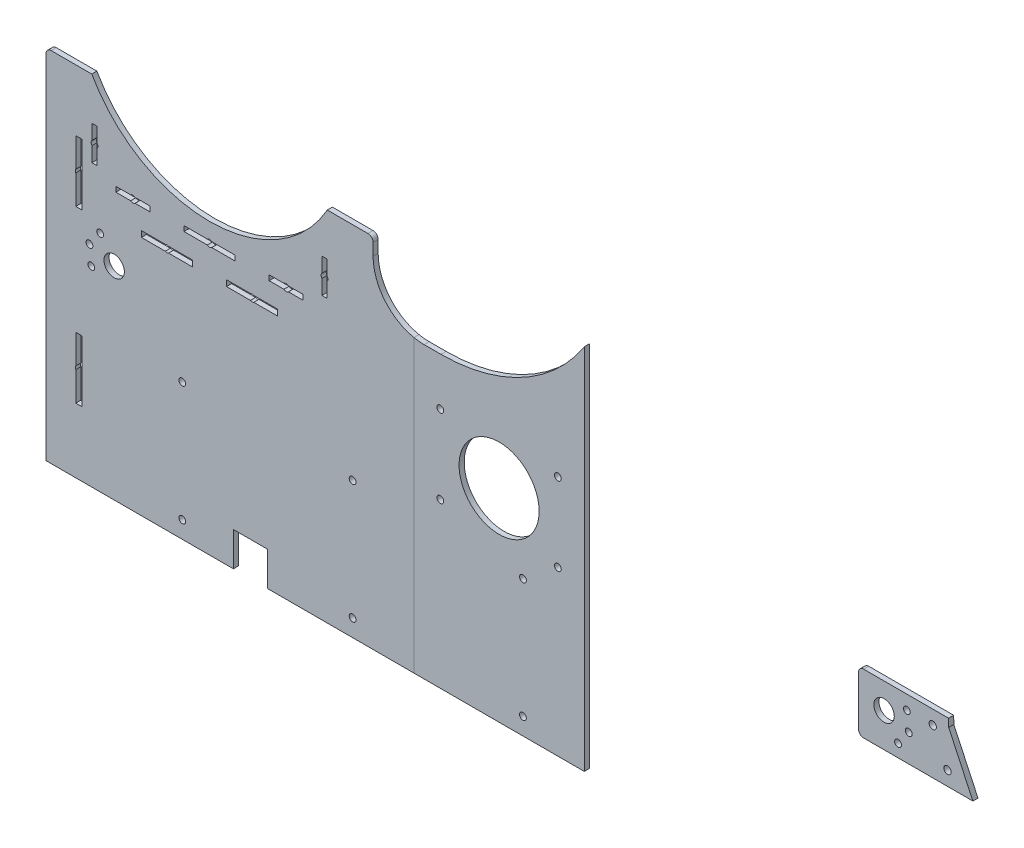
from build123d import *

# Parameters (mm, degrees)
SKETCH_1_R                   = 2
SKETCH_1_R_2                 = 6
SKETCH_1_R_3                 = 23.5
EXTRUDE_1_DEPTH              = 3
FILLET_1_R                   = 100
FILLET_2_R                   = 3
CUT_EXTRUDE_1_DEPTH          = 10
FILLET_3_R                   = 30
SKETCH_8_R                   = 2
EXTRUDE_5_DEPTH              = 3
SKETCH_7_R                   = 2
CUT_EXTRUDE_6_DEPTH          = 627.829093668
CUT_EXTRUDE_START            = -10
CUT_EXTRUDE_7_DEPTH          = 10
SPLIT_START                  = 63
SPLIT_BODIES_1_OUTLINE_W     = 622
SPLIT_BODIES_1_OUTLINE_H     = 3
SPLIT_BODIES_1_DEPTH         = 314.227231476
SPLIT_BODIES_1_2_OUTLINE_R   = 2
SPLIT_BODIES_1_2_DEPTH       = 3
SPLIT_BODIES_1_3_OUTLINE_R   = 2
SPLIT_BODIES_1_3_OUTLINE_R_2 = 23.5
SPLIT_BODIES_1_3_DEPTH       = 3
SKETCH_11_W                  = 23
SKETCH_11_H                  = 23
CUT_EXTRUDE_8_DEPTH          = 10
SKETCH_12_R                  = 5.999999999
SKETCH_12_R_2                = 1.999999999
CUT_EXTRUDE_9_DEPTH          = 10
SKETCH_13_R                  = 2
CUT_EXTRUDE_10_DEPTH         = 10
SKETCH_14_R                  = 2
CUT_EXTRUDE_11_DEPTH         = 10
SKETCH_15_OUTSIDE_W          = 695.481
SKETCH_15_OUTSIDE_H          = 785.859
SKETCH_15_OUTSIDE_W_2        = 88.236351933
SKETCH_15_OUTSIDE_H_2        = 35
CUT_EXTRUDE_12_DEPTH         = 10
EXTRUDE_6_DEPTH              = 3
FILLET_4_R                   = 3
SKETCH_17_R                  = 2.15
CUT_EXTRUDE_13_DEPTH         = 3


# Read off the part's stored shape, not the designer's step: 分割1
with BuildPart() as part:
    # 草图1 → 凸台-拉伸1 (new body)
    with BuildSketch(Plane.XY):
        with BuildLine():
            Line((-153, 90), (-153, -50))
            Line((-153, -50), (-43, -50))
            Line((-43, -50), (-43, -30))
            Line((-43, -30), (-23, -30))
            Line((-23, -30), (-23, -50))
            Line((-23, -50), (186, -50))
            Line((186, -50), (186, -27))
            Line((186, -27), (208, -27))
            Line((208, -27), (208, -50))
            Line((208, -50), (377, -50))
            Line((377, -50), (377, -40))
            ThreePointArc((377, -40), (351.416576428, 236.539566066), (265.404312441, 500.604962521))
            Line((265.404312441, 500.604962521), (265.404312441, 285))
            Line((265.404312441, 285), (162.933559346, 285))
            ThreePointArc((162.933559346, 285), (177.824282666, 167.941273759), (181.610438264, 50))
            Line((181.610438264, 50), (39, 50))
            Line((39, 50), (39, 90))
            Line((39, 90), (-153, 90))
        make_face()
        with Locations((-126.387569495, -7.765573369)):
            Circle(SKETCH_1_R, mode=Mode.SUBTRACT)
        with Locations((-127.488887394, 2.882285677)):
            Circle(SKETCH_1_R, mode=Mode.SUBTRACT)
        with Locations((-113, -1)):
            Circle(SKETCH_1_R_2, mode=Mode.SUBTRACT)
        with Locations((-73, -40)):
            Circle(SKETCH_1_R, mode=Mode.SUBTRACT)
        with Locations((-121.211188593, 11.552943156)):
            Circle(SKETCH_1_R, mode=Mode.SUBTRACT)
        with BuildLine():
            Line((-135.5, 36.968245837), (-135.5, 54))
            Line((-135.5, 54), (-132, 54))
            Line((-132, 54), (-132, 36.968245837))
            ThreePointArc((-132, 36.968245837), (-131.75, 36), (-132, 35.031754163))
            Line((-132, 35.031754163), (-132, 18))
            Line((-132, 18), (-135.5, 18))
            Line((-135.5, 18), (-135.5, 35.031754163))
            ThreePointArc((-135.5, 35.031754163), (-135.75, 36), (-135.5, 36.968245837))
        make_face(mode=Mode.SUBTRACT)
        with BuildLine():
            Line((-92, 40), (-92, 37))
            Line((-92, 37), (-100.677124344, 37))
            ThreePointArc((-100.677124344, 37), (-102, 36.5), (-103.322875656, 37))
            Line((-103.322875656, 37), (-112, 37))
            Line((-112, 37), (-112, 40))
            Line((-112, 40), (-103.322875656, 40))
            ThreePointArc((-103.322875656, 40), (-102, 40.5), (-100.677124344, 40))
            Line((-100.677124344, 40), (-92, 40))
        make_face(mode=Mode.SUBTRACT)
        with BuildLine():
            Line((-126, 56.322875656), (-126, 65))
            Line((-126, 65), (-123, 65))
            Line((-123, 65), (-123, 56.322875656))
            ThreePointArc((-123, 56.322875656), (-122.5, 55), (-123, 53.677124344))
            Line((-123, 53.677124344), (-123, 45))
            Line((-123, 45), (-126, 45))
            Line((-126, 45), (-126, 53.677124344))
            ThreePointArc((-126, 53.677124344), (-126.5, 55), (-126, 56.322875656))
        make_face(mode=Mode.SUBTRACT)
        with BuildLine():
            Line((-97, 21.5), (-97, 25))
            Line((-97, 25), (-82.968245837, 25))
            ThreePointArc((-82.968245837, 25), (-82, 25.25), (-81.031754163, 25))
            Line((-81.031754163, 25), (-67, 25))
            Line((-67, 25), (-67, 21.5))
            Line((-67, 21.5), (-81.031754163, 21.5))
            ThreePointArc((-81.031754163, 21.5), (-82, 21.25), (-82.968245837, 21.5))
            Line((-82.968245837, 21.5), (-97, 21.5))
        make_face(mode=Mode.SUBTRACT)
        with BuildLine():
            Line((-72, 37), (-72, 40))
            Line((-72, 40), (-58.322875656, 40))
            ThreePointArc((-58.322875656, 40), (-57, 40.5), (-55.677124344, 40))
            Line((-55.677124344, 40), (-42, 40))
            Line((-42, 40), (-42, 37))
            Line((-42, 37), (-55.677124344, 37))
            ThreePointArc((-55.677124344, 37), (-57, 36.5), (-58.322875656, 37))
            Line((-58.322875656, 37), (-72, 37))
        make_face(mode=Mode.SUBTRACT)
        with BuildLine():
            Line((-47, 21.5), (-47, 25))
            Line((-47, 25), (-32.968245837, 25))
            ThreePointArc((-32.968245837, 25), (-32, 25.25), (-31.031754163, 25))
            Line((-31.031754163, 25), (-17, 25))
            Line((-17, 25), (-17, 21.5))
            Line((-17, 21.5), (-31.031754163, 21.5))
            ThreePointArc((-31.031754163, 21.5), (-32, 21.25), (-32.968245837, 21.5))
            Line((-32.968245837, 21.5), (-47, 21.5))
        make_face(mode=Mode.SUBTRACT)
        with Locations((27, -40)):
            Circle(SKETCH_1_R, mode=Mode.SUBTRACT)
        with BuildLine():
            Line((-22, 37), (-22, 40))
            Line((-22, 40), (-13.322875656, 40))
            ThreePointArc((-13.322875656, 40), (-12, 40.5), (-10.677124344, 40))
            Line((-10.677124344, 40), (-2, 40))
            Line((-2, 40), (-2, 37))
            Line((-2, 37), (-10.677124344, 37))
            ThreePointArc((-10.677124344, 37), (-12, 36.5), (-13.322875656, 37))
            Line((-13.322875656, 37), (-22, 37))
        make_face(mode=Mode.SUBTRACT)
        with BuildLine():
            Line((12, 53.677124344), (12, 45))
            Line((12, 45), (9, 45))
            Line((9, 45), (9, 53.677124344))
            ThreePointArc((9, 53.677124344), (8.5, 55), (9, 56.322875656))
            Line((9, 56.322875656), (9, 65))
            Line((9, 65), (12, 65))
            Line((12, 65), (12, 56.322875656))
            ThreePointArc((12, 56.322875656), (12.5, 55), (12, 53.677124344))
        make_face(mode=Mode.SUBTRACT)
        with Locations((127, -40)):
            Circle(SKETCH_1_R, mode=Mode.SUBTRACT)
        with Locations((113, -1)):
            Circle(SKETCH_1_R_3, mode=Mode.SUBTRACT)
        with Locations((227, -40)):
            Circle(SKETCH_1_R, mode=Mode.SUBTRACT)
        with Locations((197, 36.410161514)):
            Circle(SKETCH_1_R, mode=Mode.SUBTRACT)
        with Locations((197, 76.410161514)):
            Circle(SKETCH_1_R, mode=Mode.SUBTRACT)
        with Locations((277, -40)):
            Circle(SKETCH_1_R, mode=Mode.SUBTRACT)
        with Locations((327, -40)):
            Circle(SKETCH_1_R, mode=Mode.SUBTRACT)
        with Locations((197, 116.410161514)):
            Circle(SKETCH_1_R, mode=Mode.SUBTRACT)
        with Locations((197, 156.410161514)):
            Circle(SKETCH_1_R, mode=Mode.SUBTRACT)
        with Locations((197, 196.410161514)):
            Circle(SKETCH_1_R, mode=Mode.SUBTRACT)
        with Locations((197, 236.410161514)):
            Circle(SKETCH_1_R, mode=Mode.SUBTRACT)
        with Locations((266.652617784, 221.656683726)):
            Circle(SKETCH_1_R, mode=Mode.SUBTRACT)
        with Locations((283.594692637, 185.421809645)):
            Circle(SKETCH_1_R, mode=Mode.SUBTRACT)
        with Locations((249.710542931, 257.891557807)):
            Circle(SKETCH_1_R, mode=Mode.SUBTRACT)
        with Locations((275.404312441, 415)):
            Circle(SKETCH_1_R, mode=Mode.SUBTRACT)
    extrude(amount=EXTRUDE_1_DEPTH)

    # 圆角1
    fillet_1_edges = [part.edges().sort_by_distance(p)[0] for p in [
        (181.610438264, 50, 1.5),
    ]]
    fillet(fillet_1_edges, radius=FILLET_1_R)

    # 圆角2
    fillet_2_edges = [part.edges().sort_by_distance(p)[0] for p in [
        (162.933559346, 285, 1.5),
        (-153, 90, 1.5),
        (39, 90, 1.5),
    ]]
    fillet(fillet_2_edges, radius=FILLET_2_R)

    # 草图3 → 切除-旋转1 (revolve, cut)
    with BuildSketch(Plane.XY.offset(93)):
        with BuildLine():
            Line((-57, 249), (-57, 9))
            ThreePointArc((-57, 9), (63, 129), (-57, 249))
        make_face()
    revolve(axis=Axis((-57, -897.264284178, 93), (0, 1, 0)), mode=Mode.SUBTRACT)

    # 草图4 → 切除-拉伸1 (cut)
    with BuildSketch(Plane.XY.offset(3)):
        with BuildLine():
            Line((12.130311731, 90), (8.038450166, 90))
            ThreePointArc((8.038450166, 90), (-57, 53.164652041), (-122.038450166, 90))
            Line((-122.038450166, 90), (-126.130311731, 90))
            ThreePointArc((-126.130311731, 90), (-57, 49.627460668), (12.130311731, 90))
        make_face()
    extrude(amount=-CUT_EXTRUDE_1_DEPTH, mode=Mode.SUBTRACT)

    # 圆角3
    fillet_3_edges = [part.edges().sort_by_distance(p)[0] for p in [
        (39, 50, 1.5),
    ]]
    fillet(fillet_3_edges, radius=FILLET_3_R)

    # 草图8 → 凸台-拉伸5 (add)
    with BuildSketch(Plane.XY.offset(3)):
        Polygon((-43, -50), (-153, -50), (-153, -120), (-43, -120), (-43, -100), (-23, -100), (-23, -120), (186, -120), (186, -97), (208, -97), (208, -120), (377, -120), (377, -50), (208, -50), (208, -27), (186, -27), (186, -50), (-23, -50), (-23, -30), (-43, -30), align=None)
        with Locations((-73, -110)):
            Circle(SKETCH_8_R, mode=Mode.SUBTRACT)
        with Locations((27, -110)):
            Circle(SKETCH_8_R, mode=Mode.SUBTRACT)
        with Locations((127, -110)):
            Circle(SKETCH_8_R, mode=Mode.SUBTRACT)
        with Locations((227, -110)):
            Circle(SKETCH_8_R, mode=Mode.SUBTRACT)
        with Locations((277, -110)):
            Circle(SKETCH_8_R, mode=Mode.SUBTRACT)
        with Locations((327, -110)):
            Circle(SKETCH_8_R, mode=Mode.SUBTRACT)
    extrude(amount=-EXTRUDE_5_DEPTH)

    # 草图7 → 切除-拉伸6 (cut, through all)
    with BuildSketch(Plane.XY.offset(3)):
        with Locations((78.5, 22)):
            Circle(SKETCH_7_R)
        with Locations((147.5, 22)):
            Circle(SKETCH_7_R)
        with Locations((147.5, -24)):
            Circle(SKETCH_7_R)
        with Locations((78.5, -24)):
            Circle(SKETCH_7_R)
    extrude(amount=-CUT_EXTRUDE_6_DEPTH, mode=Mode.SUBTRACT)

    # 草图9 → 切除-拉伸7 (cut)
    with BuildSketch(Plane.XY.offset(3).offset(CUT_EXTRUDE_START)):
        with BuildLine():
            Line((-135.5, 35.031754163), (-135.5, 18))
            Line((-135.5, 18), (-132, 18))
            Line((-132, 18), (-132, 35.031754163))
            ThreePointArc((-132, 35.031754163), (-131.75, 36), (-132, 36.968245837))
            Line((-132, 36.968245837), (-132, 54))
            Line((-132, 54), (-135.5, 54))
            Line((-135.5, 54), (-135.5, 36.968245837))
            ThreePointArc((-135.5, 36.968245837), (-135.75, 36), (-135.5, 35.031754163))
        make_face()
        with BuildLine():
            Line((-132, -46), (-132, -63.031754163))
            ThreePointArc((-132, -63.031754163), (-131.75, -64), (-132, -64.968245837))
            Line((-132, -64.968245837), (-132, -82))
            Line((-132, -82), (-135.5, -82))
            Line((-135.5, -82), (-135.5, -64.968245837))
            ThreePointArc((-135.5, -64.968245837), (-135.75, -64), (-135.5, -63.031754163))
            Line((-135.5, -63.031754163), (-135.5, -46))
            Line((-135.5, -46), (-132, -46))
        make_face()
    extrude(amount=CUT_EXTRUDE_7_DEPTH, mode=Mode.SUBTRACT)

    # Split Bodies 1 outline → Split Bodies 1 (cut)
    with BuildSketch(Plane.YZ.offset(SPLIT_START)):
        with Locations((191, 1.5)):
            Rectangle(SPLIT_BODIES_1_OUTLINE_W, SPLIT_BODIES_1_OUTLINE_H)
    extrude(amount=SPLIT_BODIES_1_DEPTH, mode=Mode.SUBTRACT)


with BuildPart() as body_2:
    # Split Bodies 1 2 outline → Split Bodies 1 2 (new body)
    with BuildSketch(Plane.XY):
        with BuildLine():
            Line((163, 95.910737705), (163, -120))
            Line((163, -120), (186, -120))
            Line((186, -120), (186, -97))
            Line((186, -97), (208, -97))
            Line((208, -97), (208, -120))
            Line((208, -120), (377, -120))
            Line((377, -120), (377, -40))
            ThreePointArc((377, -40), (351.416576428, 236.539566066), (265.404312441, 500.604962521))
            Line((265.404312441, 500.604962521), (265.404312441, 285))
            Line((265.404312441, 285), (166.500797038, 285))
            ThreePointArc((166.500797038, 285), (164.206174437, 283.932539034), (163.544498541, 281.489804745))
            ThreePointArc((163.544498541, 281.489804745), (172.654031933, 219.459988457), (178.641910806, 157.051439252))
            ThreePointArc((178.641910806, 157.051439252), (175.770623293, 125.214791859), (163, 95.910737705))
        make_face()
        with Locations((227, -110)):
            Circle(SPLIT_BODIES_1_2_OUTLINE_R, mode=Mode.SUBTRACT)
        with Locations((227, -40)):
            Circle(SPLIT_BODIES_1_2_OUTLINE_R, mode=Mode.SUBTRACT)
        with Locations((197, 36.410161514)):
            Circle(SPLIT_BODIES_1_2_OUTLINE_R, mode=Mode.SUBTRACT)
        with Locations((197, 76.410161514)):
            Circle(SPLIT_BODIES_1_2_OUTLINE_R, mode=Mode.SUBTRACT)
        with Locations((197, 116.410161514)):
            Circle(SPLIT_BODIES_1_2_OUTLINE_R, mode=Mode.SUBTRACT)
        with Locations((197, 156.410161514)):
            Circle(SPLIT_BODIES_1_2_OUTLINE_R, mode=Mode.SUBTRACT)
        with Locations((277, -110)):
            Circle(SPLIT_BODIES_1_2_OUTLINE_R, mode=Mode.SUBTRACT)
        with Locations((277, -40)):
            Circle(SPLIT_BODIES_1_2_OUTLINE_R, mode=Mode.SUBTRACT)
        with Locations((327, -110)):
            Circle(SPLIT_BODIES_1_2_OUTLINE_R, mode=Mode.SUBTRACT)
        with Locations((327, -40)):
            Circle(SPLIT_BODIES_1_2_OUTLINE_R, mode=Mode.SUBTRACT)
        with Locations((283.594692637, 185.421809645)):
            Circle(SPLIT_BODIES_1_2_OUTLINE_R, mode=Mode.SUBTRACT)
        with Locations((197, 196.410161514)):
            Circle(SPLIT_BODIES_1_2_OUTLINE_R, mode=Mode.SUBTRACT)
        with Locations((197, 236.410161514)):
            Circle(SPLIT_BODIES_1_2_OUTLINE_R, mode=Mode.SUBTRACT)
        with Locations((266.652617784, 221.656683726)):
            Circle(SPLIT_BODIES_1_2_OUTLINE_R, mode=Mode.SUBTRACT)
        with Locations((249.710542931, 257.891557807)):
            Circle(SPLIT_BODIES_1_2_OUTLINE_R, mode=Mode.SUBTRACT)
        with Locations((275.404312441, 415)):
            Circle(SPLIT_BODIES_1_2_OUTLINE_R, mode=Mode.SUBTRACT)
    extrude(amount=SPLIT_BODIES_1_2_DEPTH)

    # 草图11 → 切除-拉伸8 (cut)
    with BuildSketch(Plane.XY.offset(3)):
        with Locations((174.5, -108.5)):
            Rectangle(SKETCH_11_W, SKETCH_11_H)
    extrude(amount=-CUT_EXTRUDE_8_DEPTH, mode=Mode.SUBTRACT)

    # 草图12 → 切除-拉伸9 (cut)
    with BuildSketch(Plane.XY.offset(3)):
        with Locations((339.000000001, -0.999999999)):
            Circle(SKETCH_12_R)
        with Locations((353.488887395, -4.882285676)):
            Circle(SKETCH_12_R_2)
        with Locations((347.211188594, -13.552943156)):
            Circle(SKETCH_12_R_2)
        with Locations((352.387569496, 5.76557337)):
            Circle(SKETCH_12_R_2)
    extrude(amount=-CUT_EXTRUDE_9_DEPTH, mode=Mode.SUBTRACT)

    # 草图13 → 切除-拉伸10 (cut)
    with BuildSketch(Plane.XY.offset(3)):
        with Locations((197, -80)):
            Circle(SKETCH_13_R)
        with Locations((197, -60)):
            Circle(SKETCH_13_R)
    extrude(amount=-CUT_EXTRUDE_10_DEPTH, mode=Mode.SUBTRACT)

    # 草图14 → 切除-拉伸11 (cut)
    with BuildSketch(Plane.XY.offset(3)):
        with Locations((183, 41.295936886)):
            Circle(SKETCH_14_R)
    extrude(amount=-CUT_EXTRUDE_11_DEPTH, mode=Mode.SUBTRACT)

    # 草图15 outside → 切除-拉伸12 (cut)
    with BuildSketch(Plane.XY.offset(3)):
        with Locations((112.1135, 190.3025)):
            Rectangle(SKETCH_15_OUTSIDE_W, SKETCH_15_OUTSIDE_H)
        with Locations((368.118175968, -3.499999999)):
            Rectangle(SKETCH_15_OUTSIDE_W_2, SKETCH_15_OUTSIDE_H_2, mode=Mode.SUBTRACT)
    extrude(amount=-CUT_EXTRUDE_12_DEPTH, mode=Mode.SUBTRACT)

    # 草图16 → 凸台-拉伸6 (add)
    with BuildSketch(Plane.XY.offset(3)):
        with BuildLine():
            Line((391.148916275, -20.999999999), (376.967146193, 9.331270381))
            ThreePointArc((376.967146193, 9.331270381), (377.18452175, -5.833604226), (377.217887055, -20.999999999))
            Line((377.217887055, -20.999999999), (391.148916275, -20.999999999))
        make_face()
    extrude(amount=-EXTRUDE_6_DEPTH)

    # 圆角4
    fillet_4_edges = [body_2.edges().sort_by_distance(p)[0] for p in [
        (324.000000001, -20.999999999, 1.5),
        (324.000000001, 14.000000001, 1.5),
    ]]
    fillet(fillet_4_edges, radius=FILLET_4_R)

    # 草图17 → 切除-拉伸13 (cut)
    with BuildSketch(Plane.XY.offset(3)):
        with Locations((376.224335271, -12.689901349)):
            Circle(SKETCH_17_R)
        with Locations((367.567061049, 5.825849765)):
            Circle(SKETCH_17_R)
    extrude(amount=-CUT_EXTRUDE_13_DEPTH, mode=Mode.SUBTRACT)


with BuildPart() as body_3:
    # Split Bodies 1 3 outline → Split Bodies 1 3 (new body)
    with BuildSketch(Plane.XY):
        with BuildLine():
            Line((63, 50.606123087), (63, -120))
            Line((63, -120), (163, -120))
            Line((163, -120), (163, 95.910737705))
            ThreePointArc((163, 95.910737705), (126.802596049, 62.224928854), (78.890834599, 50))
            Line((78.890834599, 50), (69, 50))
            ThreePointArc((69, 50), (65.98473114, 50.15191541), (63, 50.606123087))
        make_face()
        with Locations((78.5, -24)):
            Circle(SPLIT_BODIES_1_3_OUTLINE_R, mode=Mode.SUBTRACT)
        with Locations((127, -110)):
            Circle(SPLIT_BODIES_1_3_OUTLINE_R, mode=Mode.SUBTRACT)
        with Locations((127, -40)):
            Circle(SPLIT_BODIES_1_3_OUTLINE_R, mode=Mode.SUBTRACT)
        with Locations((147.5, -24)):
            Circle(SPLIT_BODIES_1_3_OUTLINE_R, mode=Mode.SUBTRACT)
        with Locations((78.5, 22)):
            Circle(SPLIT_BODIES_1_3_OUTLINE_R, mode=Mode.SUBTRACT)
        with Locations((113, -1)):
            Circle(SPLIT_BODIES_1_3_OUTLINE_R_2, mode=Mode.SUBTRACT)
        with Locations((147.5, 22)):
            Circle(SPLIT_BODIES_1_3_OUTLINE_R, mode=Mode.SUBTRACT)
    extrude(amount=SPLIT_BODIES_1_3_DEPTH)


solid = Compound([part.part, body_2.part, body_3.part])
